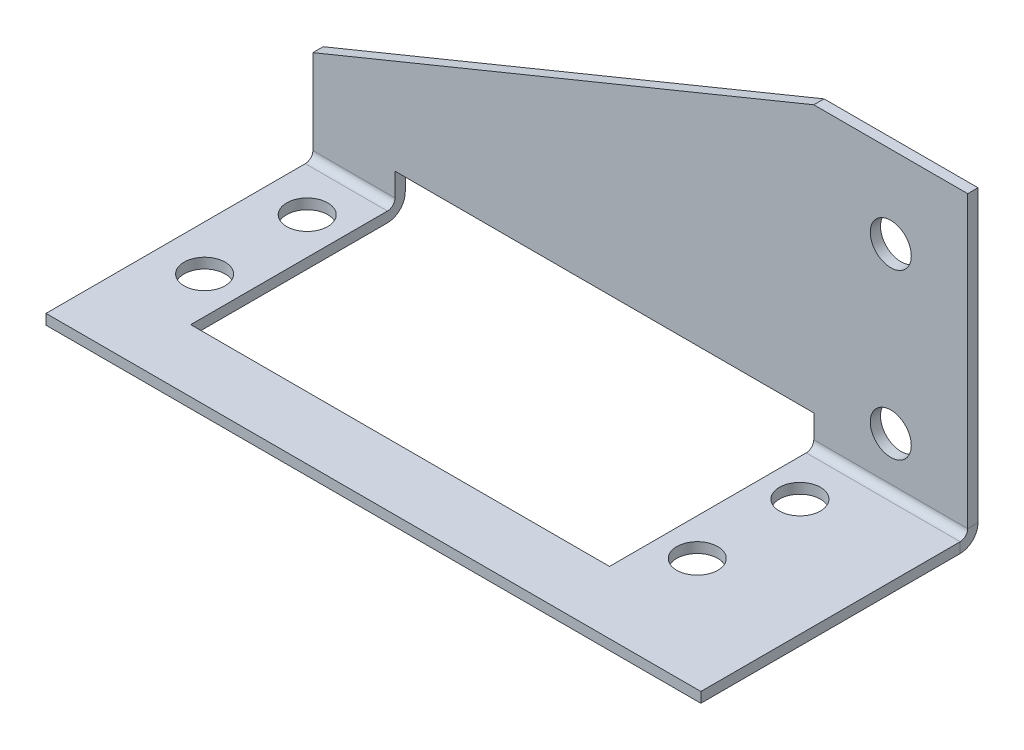
from build123d import *

# Parameters (mm, degrees)
T_LE_DE_BASE_PLI_E1_DEPTH             = 1
T_LE_PLI_E_SUR_AR_TE1_STRIP_W         = 5.4732
T_LE_PLI_E_SUR_AR_TE1_STRIP_H         = 1
T_LE_PLI_E_SUR_AR_TE1_STRIP_CUT_DEPTH = 63.8
T_LE_PLI_E_SUR_AR_TE1_DEPTH           = 63.8
ESQUISSE6_R                           = 2
ESQUISSE6_W                           = 40.8
ESQUISSE6_H                           = 20.9
ENL_V_MAT_EXTRU_1_DEPTH               = 4
ESQUISSE7_R                           = 2
ENL_V_MAT_EXTRU_2_DEPTH               = 63.908187067


# Sheet-metal steps are written as plain solids
with BuildPart() as part:
    # Esquisse1 → Tôle de base pliée1 (new body)
    with BuildSketch(Plane.XY):
        Polygon((-48.8, 10), (0, 30), (15, 30), (15, 0), (-48.8, 0), align=None)
    extrude(amount=T_LE_DE_BASE_PLI_E1_DEPTH)

    # Tôle pliée sur arête1 strip (across the edge) → Tôle pliée sur arête1 strip cut (cut)
    with BuildSketch(Plane(origin=(-48.8, 0, 1), x_dir=(0, 1, 0), z_dir=(1, 0, 0))):
        with Locations((-1, -0.5)):
            Rectangle(T_LE_PLI_E_SUR_AR_TE1_STRIP_W, T_LE_PLI_E_SUR_AR_TE1_STRIP_H)
    extrude(amount=T_LE_PLI_E_SUR_AR_TE1_STRIP_CUT_DEPTH, mode=Mode.SUBTRACT)

    # Tôle pliée sur arête1 section (across the edge) → Tôle pliée sur arête1 (add)
    with BuildSketch(Plane(origin=(-48.8, 0, 1), x_dir=(0, 1, 0), z_dir=(1, 0, 0))):
        with BuildLine():
            Line((0, 0.7366), (0, 26))
            Line((0, 26), (1, 26))
            Line((1, 26), (1, 0.7366))
            ThreePointArc((1, 0.7366), (1.215745145, 0.215745145), (1.7366, 0))
            Line((1.7366, 0), (1.7366, -1))
            ThreePointArc((1.7366, -1), (0.508638364, -0.491361636), (0, 0.7366))
        make_face()
    extrude(amount=T_LE_PLI_E_SUR_AR_TE1_DEPTH)

    # Esquisse6 → Enlèv. mat.-Extru.1 (cut)
    with BuildSketch(Plane.XZ):
        with Locations(Location((3.6, 15.95, 0), (0, 0, 270))):
            Circle(ESQUISSE6_R)
        with Locations(Location((3.6, 5.95, 0), (0, 0, 270))):
            Circle(ESQUISSE6_R)
        with Locations(Location((-44.4, 15.95, 0), (0, 0, 270))):
            Circle(ESQUISSE6_R)
        with Locations(Location((-44.4, 5.95, 0), (0, 0, 270))):
            Circle(ESQUISSE6_R)
        with Locations((-20.4, 10.45)):
            Rectangle(ESQUISSE6_W, ESQUISSE6_H)
    extrude(amount=-ENL_V_MAT_EXTRU_1_DEPTH, mode=Mode.SUBTRACT)

    # Esquisse7 → Enlèv. mat.-Extru.2 (cut, through all)
    with BuildSketch(Plane.XY.offset(1)):
        with Locations((7.5, 22)):
            Circle(ESQUISSE7_R)
        with Locations((7.5, 6)):
            Circle(ESQUISSE7_R)
    extrude(amount=-ENL_V_MAT_EXTRU_2_DEPTH, mode=Mode.SUBTRACT)


solid = part.part
